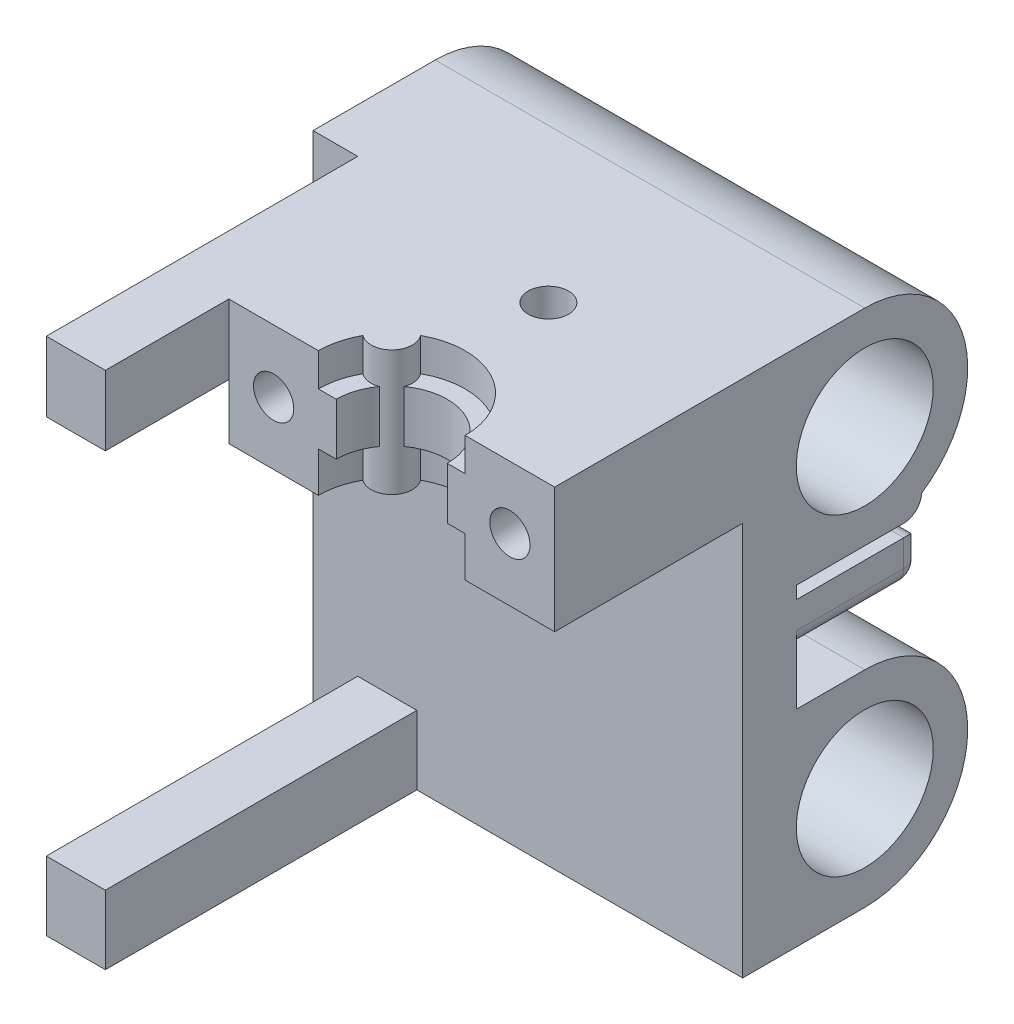
from build123d import *

# Parameters (mm, degrees)
SKETCH1_W                           = 36.4
SKETCH1_H                           = 14
NOZZLE_CLAMP_1_DEPTH                = 21
NOZZLE_CLAMP_2_DEPTH                = 14
SKETCH3_R                           = 2.25
NOZZLE_CLAMP_HEAT_SET_INSERTS_DEPTH = 4
NOZZLE_START                        = -3.7
NOZZLE_CLAMP_3_DEPTH                = 5.8
SKETCH5_W                           = 36.4
SKETCH5_H                           = 14
BACK_PLATE_DEPTH                    = 6
SKETCH13_W                          = 6.6
SKETCH13_H                          = 7.7
SKETCH13_H_2                        = 7.8
FAN_SHROUD_MOUNT_DEPTH              = 34.8
SKETCH14_R                          = 2.25
FAN_SHROUD_HEAT_SET_INSERTS_DEPTH   = 4
SKETCH16_R                          = 2.25
HEAT_SET_INSERT_FOR_EXTRUDER_DEPTH  = 7
SKETCH17_R                          = 7.65
LINEAR_BEARING_HOUSING_DEPTH        = 48
SKETCH18_R                          = 7.65
SKETCH18_R_2                        = 5.5
BOSS_EXTRUDE1_DEPTH                 = 3
SKETCH19_W                          = 8
SKETCH19_H                          = 5
BOSS_EXTRUDE2_DEPTH                 = 14
BOSS_EXTRUDE3_START                 = -8
BOSS_EXTRUDE3_DEPTH                 = 8
BOSS_EXTRUDE4_DEPTH                 = 8
FILLET1_R                           = 2


with BuildPart() as part:
    # Sketch1 → nozzle clamp 1 (new body)
    with BuildSketch(Plane.XY):
        with Locations((18.2, 7)):
            Rectangle(SKETCH1_W, SKETCH1_H)
    extrude(amount=-NOZZLE_CLAMP_1_DEPTH)

    # Sketch2 → nozzle clamp 2 (cut)
    with BuildSketch(Plane(origin=(0, 14, 0), x_dir=(1, 0, 0), z_dir=(0, 1, 0))):
        with BuildLine():
            ThreePointArc((11.019537046, 3.959918151), (10.258973737, 2.044529747), (10, 0))
            Line((10, 0), (18.2, 0))
            Line((18.2, 0), (14.028069991, 4.171930009))
            ThreePointArc((14.028069991, 4.171930009), (12.563404849, 3.503965376), (11.019537046, 3.959918151))
        make_face()
        with BuildLine():
            Line((14.028069991, 4.171930009), (18.2, 0))
            Line((18.2, 0), (26.4, 0))
            ThreePointArc((26.4, 0), (22.369452672, 7.060854369), (14.240081849, 7.180462954))
            ThreePointArc((14.240081849, 7.180462954), (14.696034624, 5.636595151), (14.028069991, 4.171930009))
        make_face()
    extrude(amount=-NOZZLE_CLAMP_2_DEPTH, mode=Mode.SUBTRACT)

    # Sketch3 → nozzle clamp heat set inserts (cut)
    with BuildSketch(Plane.XY):
        with Locations((5, 7)):
            Circle(SKETCH3_R)
        with Locations((31.4, 7)):
            Circle(SKETCH3_R)
    extrude(amount=-NOZZLE_CLAMP_HEAT_SET_INSERTS_DEPTH, mode=Mode.SUBTRACT)

    # Sketch4 → nozzle clamp 3 (add)
    with BuildSketch(Plane(origin=(0, 14, 0), x_dir=(1, 0, 0), z_dir=(0, 1, 0)).offset(NOZZLE_START)):
        with BuildLine():
            Line((12, 0), (10, 0))
            ThreePointArc((10, 0), (18.2, 8.2), (26.4, 0))
            Line((26.4, 0), (24.4, 0))
            ThreePointArc((24.4, 0), (18.2, 6.2), (12, 0))
        make_face()
    extrude(amount=-NOZZLE_CLAMP_3_DEPTH)

    # Sketch5 → back plate (add)
    with BuildSketch(Plane(origin=(0, 0, -21), x_dir=(-1, 0, 0), z_dir=(0, 0, -1))):
        Polygon((11.6, -44), (11.6, 14), (0, 14), (0, 0), (-36.4, 0), (-36.4, -44), align=None)
        with Locations((-18.2, 7)):
            Rectangle(SKETCH5_W, SKETCH5_H)
    extrude(amount=BACK_PLATE_DEPTH)

    # Sketch13 → fan shroud mount (add)
    with BuildSketch(Plane.XY.offset(-21)):
        with Locations((-3.3, -40.15)):
            Rectangle(SKETCH13_W, SKETCH13_H)
        with Locations((-3.3, 10.1)):
            Rectangle(SKETCH13_W, SKETCH13_H_2)
    extrude(amount=FAN_SHROUD_MOUNT_DEPTH)

    # Sketch14 → fan shroud heat set inserts (cut)
    with BuildSketch(Plane.ZY.offset(6.6)):
        with Locations(Location((-13.6, 10.1, 0), (0, 0, 270))):
            Circle(SKETCH14_R)
        with Locations(Location((-13.6, -40, 0), (0, 0, 270))):
            Circle(SKETCH14_R)
        with Locations(Location((6.4, -40, 0), (0, 0, 90))):
            Circle(SKETCH14_R)
        with Locations(Location((6.4, 10.1, 0), (0, 0, 90))):
            Circle(SKETCH14_R)
    extrude(amount=-FAN_SHROUD_HEAT_SET_INSERTS_DEPTH, mode=Mode.SUBTRACT)

    # Sketch16 → heat set insert for extruder (cut)
    with BuildSketch(Plane(origin=(0, 14, 0), x_dir=(1, 0, 0), z_dir=(0, 1, 0))):
        with Locations(Location((18.2, 17.5, 0), (0, 0, 180))):
            Circle(SKETCH16_R)
    extrude(amount=-HEAT_SET_INSERT_FOR_EXTRUDER_DEPTH, mode=Mode.SUBTRACT)

    # Sketch17 → linear bearing housing (add)
    # profile 1 of 2: a face of its own
    with BuildSketch(Plane.ZY.offset(11.6)):
        with BuildLine():
            Line((-21, -9), (-21, 14))
            Line((-21, 14), (-34.65, 14))
            ThreePointArc((-34.65, 14), (-46.15, 2.5), (-34.65, -9))
            Line((-34.65, -9), (-21, -9))
        make_face()
        with Locations(Location((-34.65, 2.5, 0), (0, 0, 270))):
            Circle(SKETCH17_R, mode=Mode.SUBTRACT)
    # profile 2 of 2: a face of its own
    with BuildSketch(Plane.ZY.offset(11.6)):
        with BuildLine():
            Line((-21, -21), (-34.65, -21))
            ThreePointArc((-34.65, -21), (-46.15, -32.5), (-34.65, -44))
            Line((-34.65, -44), (-21, -44))
            Line((-21, -44), (-21, -21))
        make_face()
        with Locations(Location((-34.65, -32.5, 0), (0, 0, 180))):
            Circle(SKETCH17_R, mode=Mode.SUBTRACT)
    extrude(amount=-LINEAR_BEARING_HOUSING_DEPTH)

    # Sketch18 → Boss-Extrude1 (add)
    # profile 1 of 2: a face of its own
    with BuildSketch(Plane.ZY.offset(11.6)):
        with Locations(Location((-34.65, 2.5, 0), (0, 0, 270))):
            Circle(SKETCH18_R)
        with Locations(Location((-34.65, 2.5, 0), (0, 0, 270))):
            Circle(SKETCH18_R_2, mode=Mode.SUBTRACT)
    # profile 2 of 2: a face of its own
    with BuildSketch(Plane.ZY.offset(11.6)):
        with Locations(Location((-34.65, -32.5, 0), (0, 0, 180))):
            Circle(SKETCH18_R)
        with Locations(Location((-34.65, -32.5, 0), (0, 0, 90))):
            Circle(SKETCH18_R_2, mode=Mode.SUBTRACT)
    extrude(amount=-BOSS_EXTRUDE1_DEPTH)

    # Sketch19 → Boss-Extrude2 (add)
    with BuildSketch(Plane(origin=(0, 0, -27), x_dir=(-1, 0, 0), z_dir=(0, 0, -1))):
        with Locations((-32.4, -12.9)):
            Rectangle(SKETCH19_W, SKETCH19_H)
        with Locations((7.6, -17.1)):
            Rectangle(SKETCH19_W, SKETCH19_H)
    extrude(amount=BOSS_EXTRUDE2_DEPTH)

    # Sketch20 → Boss-Extrude3 (add)
    with BuildSketch(Plane(origin=(36.4, 0, 0), x_dir=(0, 0, -1), z_dir=(1, 0, 0)).offset(BOSS_EXTRUDE3_START)):
        with BuildLine():
            Line((34.65, -9), (41, -9))
            Line((41, -9), (41, -7.087882978))
            ThreePointArc((41, -7.087882978), (37.965821599, -8.511599662), (34.65, -9))
        make_face()
    extrude(amount=BOSS_EXTRUDE3_DEPTH)

    # Sketch21 → Boss-Extrude4 (add)
    with BuildSketch(Plane.ZY.offset(11.6)):
        with BuildLine():
            Line((-34.65, -21), (-41, -21))
            Line((-41, -21), (-41, -22.912117022))
            ThreePointArc((-41, -22.912117022), (-37.965821599, -21.488400338), (-34.65, -21))
        make_face()
    extrude(amount=-BOSS_EXTRUDE4_DEPTH)

    # Fillet1
    # the kernel refuses this fillet: 2 mm, written as the material it takes off along each edge
    with BuildSketch(Plane(origin=(-5.6, -16.6, -39), x_dir=(1, 0, 0), z_dir=(0, 1, 0))) as fillet1_piece_1_section:
        Polygon((0, 0), (FILLET1_R * 1.02, 0), (FILLET1_R * 1.02, FILLET1_R * 1.02), (0, FILLET1_R * 1.02), align=None)
    fillet1_piece_1 = extrude(amount=FILLET1_R * 1.02, mode=Mode.PRIVATE)
    fillet1_piece_1 = fillet1_piece_1 - Plane(origin=(-5.6, -16.6, -39), x_dir=(-0.7071067811865475, 0, 0.7071067811865475), z_dir=(0, 1, 0)) * Sphere(FILLET1_R, mode=Mode.PRIVATE)
    add(fillet1_piece_1, mode=Mode.SUBTRACT)
    with BuildSketch(Plane(origin=(-9.6, -16.6, -39), x_dir=(0, 0, -1), z_dir=(0, 1, 0))) as fillet1_piece_2_section:
        Polygon((0, 0), (FILLET1_R * 1.02, 0), (FILLET1_R * 1.02, FILLET1_R * 1.02), (0, FILLET1_R * 1.02), align=None)
    fillet1_piece_2 = extrude(amount=FILLET1_R * 1.02, mode=Mode.PRIVATE)
    fillet1_piece_2 = fillet1_piece_2 - Plane(origin=(-9.6, -16.6, -39), x_dir=(0.7071067811865475, 0, 0.7071067811865475), z_dir=(0, 1, 0)) * Sphere(FILLET1_R, mode=Mode.PRIVATE)
    add(fillet1_piece_2, mode=Mode.SUBTRACT)
    with BuildSketch(Plane(origin=(30.4, -13.4, -39), x_dir=(0, -1, 0), z_dir=(-1, 0, 0))) as fillet1_piece_3_section:
        Polygon((0, 0), (FILLET1_R * 1.02, 0), (FILLET1_R * 1.02, -FILLET1_R * 1.02), (0, -FILLET1_R * 1.02), align=None)
    fillet1_piece_3 = extrude(amount=FILLET1_R * 1.02, mode=Mode.PRIVATE)
    fillet1_piece_3 = fillet1_piece_3 - Plane(origin=(30.4, -13.4, -39), x_dir=(0, 0.7071067811865475, 0.7071067811865475), z_dir=(-1, 0, 0)) * Sphere(FILLET1_R, mode=Mode.PRIVATE)
    add(fillet1_piece_3, mode=Mode.SUBTRACT)
    with BuildSketch(Plane(origin=(34.4, -13.4, -39), x_dir=(1, 0, 0), z_dir=(0, -1, 0))) as fillet1_piece_4_section:
        Polygon((0, 0), (FILLET1_R * 1.02, 0), (FILLET1_R * 1.02, -FILLET1_R * 1.02), (0, -FILLET1_R * 1.02), align=None)
    fillet1_piece_4 = extrude(amount=FILLET1_R * 1.02, mode=Mode.PRIVATE)
    fillet1_piece_4 = fillet1_piece_4 - Plane(origin=(34.4, -13.4, -39), x_dir=(-0.7071067811865475, 0, 0.7071067811865475), z_dir=(0, -1, 0)) * Sphere(FILLET1_R, mode=Mode.PRIVATE)
    add(fillet1_piece_4, mode=Mode.SUBTRACT)
    with BuildSketch(Plane(origin=(-16.6, -19.6, -41), x_dir=(0, 1, 0), z_dir=(1, 0, 0))) as fillet1_piece_5:
        with BuildLine():
            CenterArc((FILLET1_R, FILLET1_R), FILLET1_R, 180, 90)
            Line((0, FILLET1_R), (0, 0))
            Line((0, 0), (FILLET1_R, 0))
        make_face()
    extrude(amount=18, mode=Mode.SUBTRACT)
    with BuildSketch(Plane(origin=(-3.6, -24.6, -41), x_dir=(0, 0, 1), z_dir=(0, 1, 0))) as fillet1_piece_6_section:
        with BuildLine():
            CenterArc((FILLET1_R, -FILLET1_R), FILLET1_R, 90, 90)
            Line((0, -FILLET1_R), (0, 0))
            Line((0, 0), (FILLET1_R, 0))
        make_face()
    fillet1_piece_6 = extrude(amount=8, mode=Mode.PRIVATE)
    fillet1_piece_6 = split(fillet1_piece_6, bisect_by=Plane(origin=(-4.046735878, -21, -40.553264122), z_dir=(0, 1, 0)), keep=Keep.TOP, mode=Mode.PRIVATE)
    add(fillet1_piece_6, mode=Mode.SUBTRACT)
    with BuildSketch(Plane(origin=(-5.6, -14.6, -41), x_dir=(0, 0, 1), z_dir=(-1, 0, 0))) as fillet1_piece_7:
        with BuildLine():
            CenterArc((FILLET1_R, -FILLET1_R), FILLET1_R, 90, 90)
            Line((0, -FILLET1_R), (0, 0))
            Line((0, 0), (FILLET1_R, 0))
        make_face()
    extrude(amount=4, mode=Mode.SUBTRACT)
    with BuildSketch(Plane(origin=(-11.6, -16.6, -41), x_dir=(0, 0, 1), z_dir=(0, -1, 0))) as fillet1_piece_8_section:
        with BuildLine():
            CenterArc((FILLET1_R, -FILLET1_R), FILLET1_R, 90, 90)
            Line((0, -FILLET1_R), (0, 0))
            Line((0, 0), (FILLET1_R, 0))
        make_face()
    fillet1_piece_8 = extrude(amount=8, mode=Mode.PRIVATE)
    fillet1_piece_8 = split(fillet1_piece_8, bisect_by=Plane(origin=(-11.153264122, -21, -40.553264122), z_dir=(0, 1, 0)), keep=Keep.TOP, mode=Mode.PRIVATE)
    add(fillet1_piece_8, mode=Mode.SUBTRACT)
    with BuildSketch(Plane(origin=(41.4, -10.4, -41), x_dir=(0, 0, 1), z_dir=(-1, 0, 0))) as fillet1_piece_9:
        with BuildLine():
            CenterArc((FILLET1_R, -FILLET1_R), FILLET1_R, 90, 90)
            Line((0, -FILLET1_R), (0, 0))
            Line((0, 0), (FILLET1_R, 0))
        make_face()
    extrude(amount=18, mode=Mode.SUBTRACT)
    with BuildSketch(Plane(origin=(28.4, -10.4, -41), x_dir=(1, 0, 0), z_dir=(0, -1, 0)), Plane(origin=(36.4, -13.4, -41), x_dir=(-1, 0, 0), z_dir=(0, 1, 0))) as fillet1_piece_10:
        with BuildLine():
            CenterArc((FILLET1_R, FILLET1_R), FILLET1_R, 180, 90)
            Line((0, FILLET1_R), (0, 0))
            Line((0, 0), (FILLET1_R, 0))
        make_face()
    extrude(amount=3, mode=Mode.SUBTRACT)
    with BuildSketch(Plane(origin=(30.4, -15.4, -41), x_dir=(0, 1, 0), z_dir=(1, 0, 0))) as fillet1_piece_11:
        with BuildLine():
            CenterArc((FILLET1_R, FILLET1_R), FILLET1_R, 180, 90)
            Line((0, FILLET1_R), (0, 0))
            Line((0, 0), (FILLET1_R, 0))
        make_face()
    extrude(amount=4, mode=Mode.SUBTRACT)
    with BuildSketch(Plane(origin=(23.404829469, -9, -41), x_dir=(0, 0, 1), z_dir=(1, 0, 0))) as fillet1_piece_12:
        with BuildLine():
            CenterArc((1.998068213, -2), FILLET1_R, 90, 87.481527223)
            Line((0, -1.912117022), (0, 0))
            Line((0, 0), (1.998068213, 0))
        make_face()
    extrude(amount=17.990341063, mode=Mode.SUBTRACT)
    with BuildSketch(Plane(origin=(-16.595170531, -21, -41), x_dir=(0, 0, 1), z_dir=(1, 0, 0))) as fillet1_piece_13:
        with BuildLine():
            CenterArc((1.998068213, 2), FILLET1_R, 182.518472777, 87.481527223)
            Line((0, 1.912117022), (0, 0))
            Line((0, 0), (1.998068213, 0))
        make_face()
    extrude(amount=17.990341063, mode=Mode.SUBTRACT)
    with BuildSketch(Plane(origin=(-11.6, -14.6, -27), x_dir=(0, -1, 0), z_dir=(0, 0, -1)), Plane(origin=(-3.6, -14.6, -27), x_dir=(-1, 0, 0), z_dir=(0, 0, -1))) as fillet1_piece_14:
        with BuildLine():
            CenterArc((FILLET1_R, -FILLET1_R), FILLET1_R, 90, 90)
            Line((0, -FILLET1_R), (0, 0))
            Line((0, 0), (FILLET1_R, 0))
        make_face()
    extrude(amount=12, mode=Mode.SUBTRACT)
    with BuildSketch(Plane(origin=(28.4, -15.4, -27), x_dir=(0, 1, 0), z_dir=(0, 0, -1)), Plane(origin=(36.4, -15.4, -27), x_dir=(-1, 0, 0), z_dir=(0, 0, -1))) as fillet1_piece_15:
        with BuildLine():
            CenterArc((FILLET1_R, FILLET1_R), FILLET1_R, 180, 90)
            Line((0, FILLET1_R), (0, 0))
            Line((0, 0), (FILLET1_R, 0))
        make_face()
    extrude(amount=12, mode=Mode.SUBTRACT)


solid = part.part
